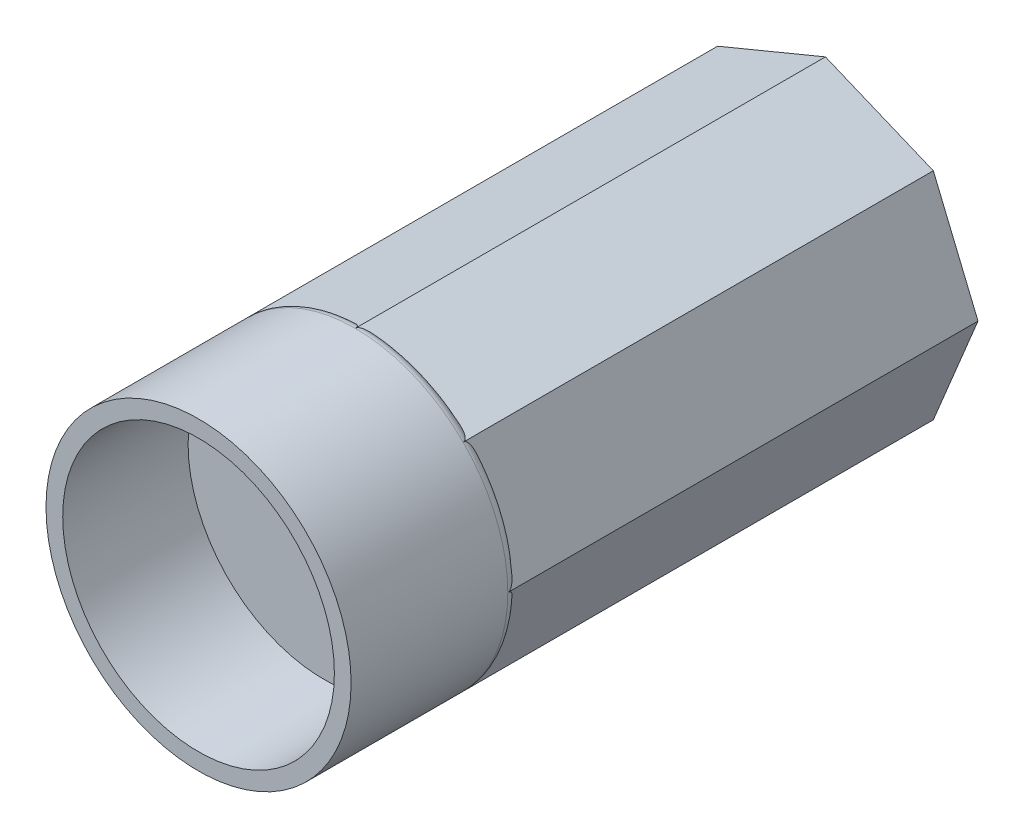
from build123d import *

# Parameters (mm, degrees)
SKETCH1_R           = 7.3
BOSS_EXTRUDE1_DEPTH = 30
SKETCH2_R           = 6.5
CUT_EXTRUDE1_DEPTH  = 6
SKETCH3_OUTSIDE_W   = 23.884
SKETCH3_OUTSIDE_H   = 23.884
CUT_EXTRUDE3_DEPTH  = 22
FILLET2_R           = 0.5


with BuildPart() as part:
    # Sketch1 → Boss-Extrude1 (new body)
    with BuildSketch(Plane.XY):
        Circle(SKETCH1_R)
    extrude(amount=BOSS_EXTRUDE1_DEPTH)

    # Sketch2 → Cut-Extrude1 (cut)
    with BuildSketch(Plane.XY.offset(30)):
        Circle(SKETCH2_R)
    extrude(amount=-CUT_EXTRUDE1_DEPTH, mode=Mode.SUBTRACT)

    # Sketch3 outside → Cut-Extrude3 (cut)
    with BuildSketch(Plane(origin=(0, 0, 0), x_dir=(-1, 0, 0), z_dir=(0, 0, -1))):
        Rectangle(SKETCH3_OUTSIDE_W, SKETCH3_OUTSIDE_H)
        Polygon((7.3, 0), (5.161879503, 5.161879503), (0, 7.3), (-5.161879503, 5.161879503), (-7.3, 0), (-5.161879503, -5.161879503), (0, -7.3), (5.161879503, -5.161879503), align=None, mode=Mode.SUBTRACT)
    extrude(amount=-CUT_EXTRUDE3_DEPTH, mode=Mode.SUBTRACT)

    # Fillet2
    # the kernel refuses this fillet: 0.5 mm, written as the material it takes off along each edge
    with BuildSketch(Plane(origin=(0, 0, 22), x_dir=(1, 0, 0), z_dir=(0, 1, 0))) as fillet2_piece_1_section:
        with BuildLine():
            CenterArc((7.3 - FILLET2_R, -FILLET2_R), FILLET2_R, 0, 90)
            Line((7.3, -FILLET2_R), (7.3, 0))
            Line((7.3, 0), (7.3 - FILLET2_R, 0))
        make_face()
    fillet2_piece_1 = revolve(axis=Axis((0, 0, 22), (0, 0, -1)), revolution_arc=45, mode=Mode.PRIVATE)
    fillet2_piece_1 = split(fillet2_piece_1, bisect_by=Plane(origin=(6.230939751, -2.580939751, 22.141608604), z_dir=(0.9238795325112824, -0.3826834323651005, 0)), keep=Keep.TOP, mode=Mode.PRIVATE)
    add(fillet2_piece_1, mode=Mode.SUBTRACT)
    with BuildSketch(Plane(origin=(0, 0, 22), x_dir=(0.7071067811865394, -0.7071067811865557, 0), z_dir=(0.7071067811865557, 0.7071067811865394, 0))) as fillet2_piece_2_section:
        with BuildLine():
            CenterArc((7.3 - FILLET2_R, -FILLET2_R), FILLET2_R, 0, 90)
            Line((7.3 - FILLET2_R, 0), (7.3, 0))
            Line((7.3, 0), (7.3, -FILLET2_R))
        make_face()
    fillet2_piece_2 = revolve(axis=Axis((0, 0, 22), (0, 0, -1)), revolution_arc=45, mode=Mode.PRIVATE)
    fillet2_piece_2 = split(fillet2_piece_2, bisect_by=Plane(origin=(2.580939751, -6.230939751, 22.141608605), z_dir=(0.3826834323650794, -0.9238795325112911, 0)), keep=Keep.TOP, mode=Mode.PRIVATE)
    add(fillet2_piece_2, mode=Mode.SUBTRACT)
    with BuildSketch(Plane(origin=(0, 0, 22), x_dir=(0, -1, 0), z_dir=(1, 0, 0))) as fillet2_piece_3_section:
        with BuildLine():
            CenterArc((7.3 - FILLET2_R, -FILLET2_R), FILLET2_R, 0, 90)
            Line((7.3 - FILLET2_R, 0), (7.3, 0))
            Line((7.3, 0), (7.3, -FILLET2_R))
        make_face()
    fillet2_piece_3 = revolve(axis=Axis((0, 0, 22), (0, 0, -1)), revolution_arc=45, mode=Mode.PRIVATE)
    fillet2_piece_3 = split(fillet2_piece_3, bisect_by=Plane(origin=(-2.580939751, -6.230939751, 22.141608604), z_dir=(-0.38268343236510044, -0.9238795325112824, 0)), keep=Keep.TOP, mode=Mode.PRIVATE)
    add(fillet2_piece_3, mode=Mode.SUBTRACT)
    with BuildSketch(Plane(origin=(0, 0, 22), x_dir=(-0.7071067811865553, -0.7071067811865397, 0), z_dir=(0.7071067811865397, -0.7071067811865553, 0))) as fillet2_piece_4_section:
        with BuildLine():
            CenterArc((7.3 - FILLET2_R, -FILLET2_R), FILLET2_R, 0, 90)
            Line((7.3 - FILLET2_R, 0), (7.3, 0))
            Line((7.3, 0), (7.3, -FILLET2_R))
        make_face()
    fillet2_piece_4 = revolve(axis=Axis((0, 0, 22), (0, 0, -1)), revolution_arc=45, mode=Mode.PRIVATE)
    fillet2_piece_4 = split(fillet2_piece_4, bisect_by=Plane(origin=(-6.230939751, -2.580939751, 22.141608603), z_dir=(-0.9238795325112912, -0.3826834323650791, 0)), keep=Keep.TOP, mode=Mode.PRIVATE)
    add(fillet2_piece_4, mode=Mode.SUBTRACT)
    with BuildSketch(Plane(origin=(0, 0, 22), x_dir=(-1, 0, 0), z_dir=(0, -1, 0))) as fillet2_piece_5_section:
        with BuildLine():
            CenterArc((7.3 - FILLET2_R, -FILLET2_R), FILLET2_R, 0, 90)
            Line((7.3 - FILLET2_R, 0), (7.3, 0))
            Line((7.3, 0), (7.3, -FILLET2_R))
        make_face()
    fillet2_piece_5 = revolve(axis=Axis((0, 0, 22), (0, 0, -1)), revolution_arc=45, mode=Mode.PRIVATE)
    fillet2_piece_5 = split(fillet2_piece_5, bisect_by=Plane(origin=(-6.230939751, 2.580939751, 22.141608604), z_dir=(-0.9238795325112823, 0.38268343236510055, 0)), keep=Keep.TOP, mode=Mode.PRIVATE)
    add(fillet2_piece_5, mode=Mode.SUBTRACT)
    with BuildSketch(Plane(origin=(0, 0, 22), x_dir=(-0.7071067811865395, 0.7071067811865556, 0), z_dir=(-0.7071067811865556, -0.7071067811865395, 0))) as fillet2_piece_6_section:
        with BuildLine():
            CenterArc((7.3 - FILLET2_R, -FILLET2_R), FILLET2_R, 0, 90)
            Line((7.3 - FILLET2_R, 0), (7.3, 0))
            Line((7.3, 0), (7.3, -FILLET2_R))
        make_face()
    fillet2_piece_6 = revolve(axis=Axis((0, 0, 22), (0, 0, -1)), revolution_arc=45, mode=Mode.PRIVATE)
    fillet2_piece_6 = split(fillet2_piece_6, bisect_by=Plane(origin=(-2.580939751, 6.230939751, 22.141608604), z_dir=(-0.3826834323650789, 0.9238795325112913, 0)), keep=Keep.TOP, mode=Mode.PRIVATE)
    add(fillet2_piece_6, mode=Mode.SUBTRACT)
    with BuildSketch(Plane(origin=(0, 0, 22), x_dir=(0, 1, 0), z_dir=(-1, 0, 0))) as fillet2_piece_7_section:
        with BuildLine():
            CenterArc((7.3 - FILLET2_R, -FILLET2_R), FILLET2_R, 0, 90)
            Line((7.3, -FILLET2_R), (7.3, 0))
            Line((7.3, 0), (7.3 - FILLET2_R, 0))
        make_face()
    fillet2_piece_7 = revolve(axis=Axis((0, 0, 22), (0, 0, -1)), revolution_arc=45, mode=Mode.PRIVATE)
    fillet2_piece_7 = split(fillet2_piece_7, bisect_by=Plane(origin=(2.580939751, 6.230939751, 22.141608604), z_dir=(0.38268343236510044, 0.9238795325112824, 0)), keep=Keep.TOP, mode=Mode.PRIVATE)
    add(fillet2_piece_7, mode=Mode.SUBTRACT)
    with BuildSketch(Plane(origin=(0, 0, 22), x_dir=(0.7071067811865556, 0.7071067811865395, 0), z_dir=(-0.7071067811865395, 0.7071067811865556, 0))) as fillet2_piece_8_section:
        with BuildLine():
            CenterArc((7.3 - FILLET2_R, -FILLET2_R), FILLET2_R, 0, 90)
            Line((7.3, -FILLET2_R), (7.3, 0))
            Line((7.3, 0), (7.3 - FILLET2_R, 0))
        make_face()
    fillet2_piece_8 = revolve(axis=Axis((0, 0, 22), (0, 0, -1)), revolution_arc=45, mode=Mode.PRIVATE)
    fillet2_piece_8 = split(fillet2_piece_8, bisect_by=Plane(origin=(6.230939751, 2.580939751, 22.141608603), z_dir=(0.9238795325112913, 0.38268343236507885, 0)), keep=Keep.TOP, mode=Mode.PRIVATE)
    add(fillet2_piece_8, mode=Mode.SUBTRACT)


solid = part.part
